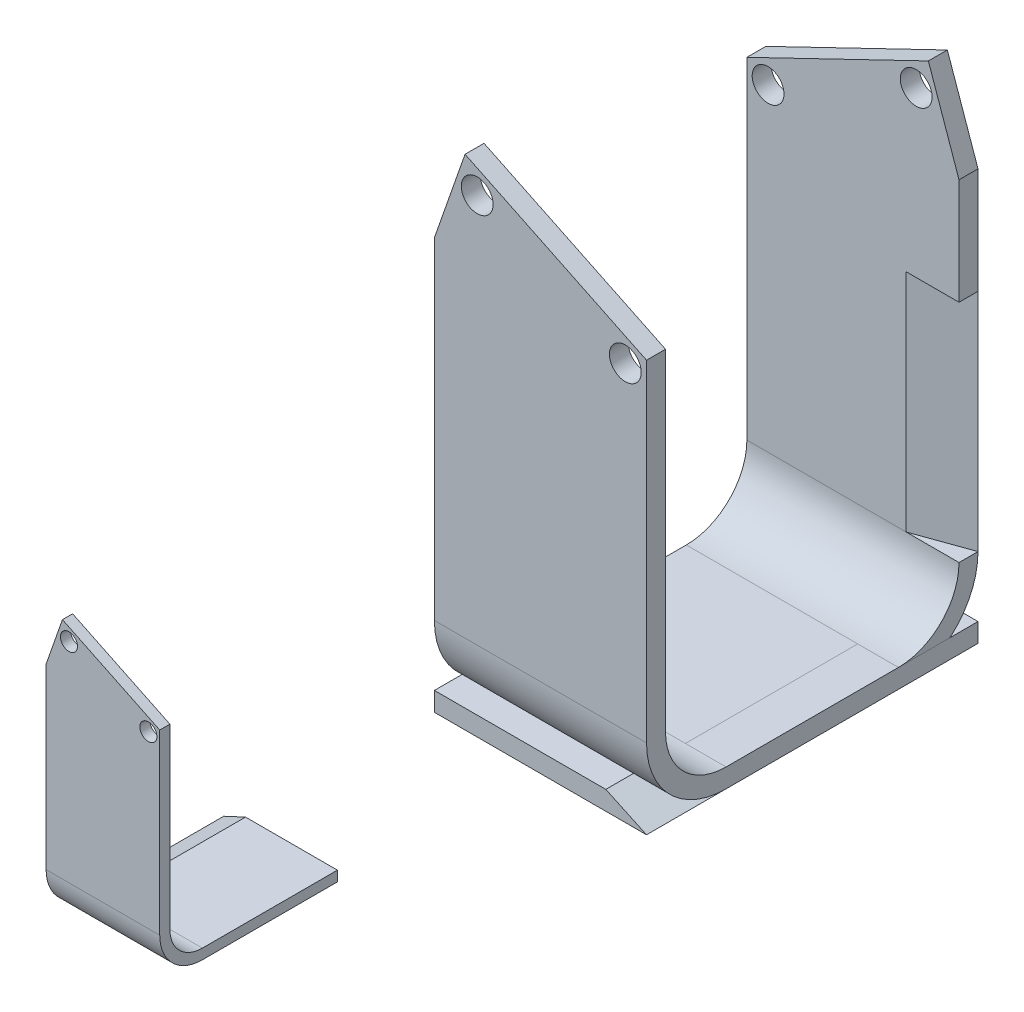
from build123d import *

# Parameters (mm, degrees)
BOSS_EXTRUDE1_DEPTH   = 80
BOSS_EXTRUDE2_DEPTH   = 7.16
SKETCH3_R             = 6
CUT_EXTRUDE1_DEPTH    = 7.16
CUT_EXTRUDE6_DEPTH    = 95
CUT_EXTRUDE7_DEPTH    = 85
BODY_MOVE_COPY5_ANGLE = 180
CHAMFER1_SIZE         = 7
CHAMFER1_SIZE_2       = 7.248712197
SCALE1_SCALE          = 0.714781685
SCALE2_SCALE          = 0.5
SCALE3_SCALE          = 1.5


with BuildPart() as part:
    # Sketch1 → Boss-Extrude1 (new body)
    with BuildSketch(Plane(origin=(0, 0, 0), x_dir=(0, 0, -1), z_dir=(1, 0, 0))):
        with BuildLine():
            Line((-43.05875576, 0), (51.94124424, 0))
            ThreePointArc((51.94124424, 0), (73.154447675, 8.786796564), (81.94124424, 30))
            Line((81.94124424, 30), (81.94124424, 155))
            Line((81.94124424, 155), (74.78124424, 155))
            Line((74.78124424, 155), (74.78124424, 30))
            ThreePointArc((74.78124424, 30), (68.091563122, 13.849681118), (51.94124424, 7.16))
            Line((51.94124424, 7.16), (-43.05875576, 7.16))
            Line((-43.05875576, 7.16), (-43.05875576, 0))
        make_face()
    extrude(amount=BOSS_EXTRUDE1_DEPTH)

    # Sketch2 → Boss-Extrude2 (add)
    with BuildSketch(Plane.XY.offset(-74.78124424)):
        Polygon((0, 155), (68.44375, 188.037147061), (80, 155), align=None)
    extrude(amount=-BOSS_EXTRUDE2_DEPTH)

    # Sketch3 → Cut-Extrude1 (cut)
    with BuildSketch(Plane.XY.offset(-74.78124424)):
        with Locations((63.851173507, 176.937147061)):
            Circle(SKETCH3_R)
        with Locations((8, 149.978316888)):
            Circle(SKETCH3_R)
    extrude(amount=-CUT_EXTRUDE1_DEPTH, mode=Mode.SUBTRACT)

    # Sketch6 → Cut-Extrude6 (cut)
    with BuildSketch(Plane.XY.offset(43.05875576)):
        Polygon((80, 0), (64.645330449, 7.16), (80, 7.16), align=None)
    extrude(amount=-CUT_EXTRUDE6_DEPTH, mode=Mode.SUBTRACT)

    # Sketch10 → Cut-Extrude7 (cut)
    with BuildSketch(Plane(origin=(0, 115, 0), x_dir=(-1, 0, 0), z_dir=(0, -1, 0))):
        Polygon((-80, 81.94124424), (-60, 74.78124424), (-80, 74.78124424), align=None)
    extrude(amount=CUT_EXTRUDE7_DEPTH, mode=Mode.SUBTRACT)


with BuildPart() as body_2:
    # Body-Move/Copy5: copy of part
    add(part.part.rotate(Axis((40, 0, -19.44124424), (0, 1, 0)), BODY_MOVE_COPY5_ANGLE))


with BuildPart() as body_3:
    # Body-Move/Copy6: copy of body 2
    add(body_2.part.moved(Location((0, 0, 180))))

    # Chamfer1
    # the kernel refuses this chamfer: 7.248712197, 7 mm, written as the material it takes off along each edge
    with BuildSketch(Plane(origin=(0, 30, 193.05875576), x_dir=(-4.3395359515607355e-15, 0.7290125666970131, 0.684500312343123), z_dir=(4.621730896647766e-15, 0.684500312343123, -0.7290125666970131))) as chamfer1_piece_1:
        Polygon((22.84, CHAMFER1_SIZE), (22.84 + CHAMFER1_SIZE_2, 0), (22.84, 0), align=None)
    revolve(axis=Axis((0, 30, 193.05875576), (1, 0, 0)), revolution_arc=183.607355582, mode=Mode.SUBTRACT)


with BuildPart() as body_3_1:
    # Scale1: scaled about (42.248049125, 54.740546913, 193.021894029)
    add(body_3.part.scale(SCALE1_SCALE).moved(Location((12.049917373, 15.613006539, 55.053379325))))


with BuildPart() as body_3_2:
    # Scale2: scaled about (42.248049125, 54.740546913, 193.021894029)
    add(body_3_1.part.scale(SCALE2_SCALE).moved(Location((21.124024563, 27.370273457, 96.510947015))))


with BuildPart() as body_3_3:
    # Scale3: scaled about (42.248049125, 54.740546913, 193.021894029)
    add(body_3_2.part.scale(SCALE3_SCALE).moved(Location((-21.124024563, -27.370273457, -96.510947015))))


solid = Compound([part.part, body_2.part, body_3_3.part])
